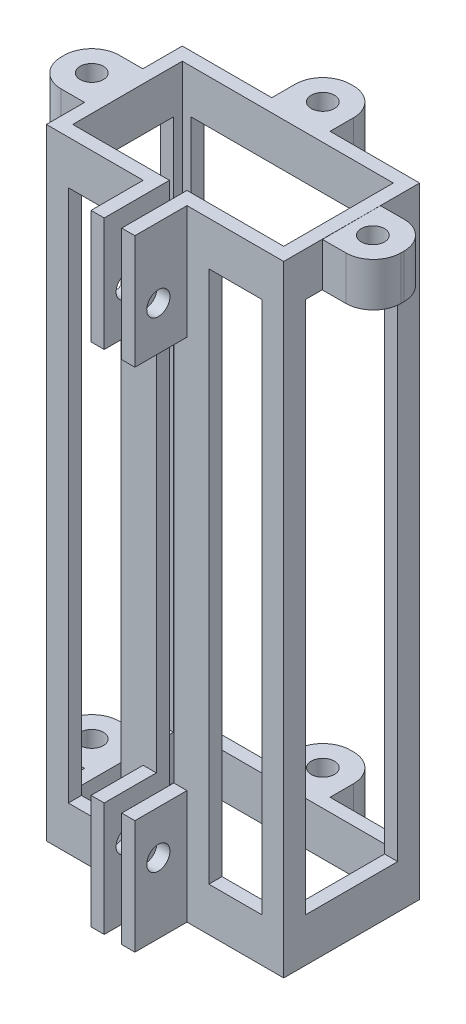
from build123d import *

# Parameters (mm, degrees)
BOSS_EXTRUDE1_DEPTH = 89.916
SKETCH2_W           = 28.036759992
SKETCH2_H           = 77.216
CUT_EXTRUDE1_DEPTH  = 1.905
SKETCH4_R           = 1.68021
CUT_EXTRUDE2_DEPTH  = 41.916
SKETCH5_R           = 1.68021
BOSS_EXTRUDE2_DEPTH = 6.35
SKETCH6_W           = 7.668379996
SKETCH6_H           = 77.216
CUT_EXTRUDE3_DEPTH  = 2.54
CUT_EXTRUDE4_DEPTH  = 12.7
SKETCH8_W           = 13.335
SKETCH8_H           = 77.216
CUT_EXTRUDE5_DEPTH  = 43.18
LPATTERN1_OUTLINE_R = 1.68021
LPATTERN1_DEPTH     = 6.35


# Read off the part's stored shape, not the designer's step: LPattern1
with BuildPart() as part:
    # Sketch1 → Boss-Extrude1 (new body)
    with BuildSketch(Plane(origin=(0, 0, 0), x_dir=(1, 0, 0), z_dir=(0, 1, 0))):
        Polygon((-15.28599651, -7.274771053), (-15.28599651, -0.044914733), (-15.28599651, 7.184941588), (-15.28599651, 7.892585267), (15.290763482, 7.892585267), (15.290763482, 7.184941588), (15.290763482, -7.274771053), (15.290763482, -7.982414733), (1.272383486, -7.982414733), (1.272383486, -17.434771053), (3.177383486, -17.434771053), (3.177383486, -9.887414733), (17.195763482, -9.887414733), (17.195763482, -7.982414733), (17.195763482, 9.797585267), (-15.28599651, 9.797585267), (-17.19099651, 9.797585267), (-17.19099651, -9.887414733), (-3.172616514, -9.887414733), (-3.172616514, -10.640741484), (-3.172616514, -17.434771053), (-1.267616514, -17.434771053), (-1.267616514, -7.982414733), (-15.28599651, -7.982414733), align=None)
    extrude(amount=BOSS_EXTRUDE1_DEPTH)

    # Sketch2 → Cut-Extrude1 (cut)
    with BuildSketch(Plane(origin=(0, 0, -9.797585267), x_dir=(-1, 0, 0), z_dir=(0, 0, -1))):
        with Locations((-0.002383486, 44.958)):
            Rectangle(SKETCH2_W, SKETCH2_H)
    extrude(amount=-CUT_EXTRUDE1_DEPTH, mode=Mode.SUBTRACT)

    # Sketch4 → Cut-Extrude2 (cut)
    with BuildSketch(Plane.ZY.offset(3.172616514)):
        with Locations((14.037756268, 10.16)):
            Circle(SKETCH4_R)
        with Locations((14.037756268, 79.756)):
            Circle(SKETCH4_R)
    extrude(amount=-CUT_EXTRUDE2_DEPTH, mode=Mode.SUBTRACT)

    # Sketch5 → Boss-Extrude2 (add)
    # profile 1 of 3: a face of its own
    with BuildSketch(Plane(origin=(0, 89.916, 0), x_dir=(1, 0, 0), z_dir=(0, 1, 0))):
        with BuildLine():
            Line((-24.58620651, 0.079810052), (-24.58620651, -0.360609948))
            ThreePointArc((-24.58620651, -0.360609948), (-23.414633635, -3.189037073), (-20.58620651, -4.360609948))
            Line((-20.58620651, -4.360609948), (-17.19099651, -4.360609948))
            Line((-17.19099651, -4.360609948), (-17.19099651, 4.079810052))
            Line((-17.19099651, 4.079810052), (-20.58620651, 4.079810052))
            ThreePointArc((-20.58620651, 4.079810052), (-23.414633635, 2.908237176), (-24.58620651, 0.079810052))
        make_face()
        with Locations(Location((-20.36599651, -0.140399948, 0), (0, 0, 270))):
            Circle(SKETCH5_R, mode=Mode.SUBTRACT)
    # profile 2 of 3: a face of its own
    with BuildSketch(Plane(origin=(0, 89.916, 0), x_dir=(1, 0, 0), z_dir=(0, 1, 0))):
        with BuildLine():
            Line((-4.22021, 13.192795267), (-4.22021, 9.797585267))
            Line((-4.22021, 9.797585267), (4.22021, 9.797585267))
            Line((4.22021, 9.797585267), (4.22021, 13.192795267))
            ThreePointArc((4.22021, 13.192795267), (3.048637125, 16.021222392), (0.22021, 17.192795267))
            Line((0.22021, 17.192795267), (-0.22021, 17.192795267))
            ThreePointArc((-0.22021, 17.192795267), (-3.048637125, 16.021222392), (-4.22021, 13.192795267))
        make_face()
        with Locations(Location((0, 12.972585267, 0), (0, 0, 270))):
            Circle(SKETCH5_R, mode=Mode.SUBTRACT)
    # profile 3 of 3: a face of its own
    with BuildSketch(Plane(origin=(0, 89.916, 0), x_dir=(1, 0, 0), z_dir=(0, 1, 0))):
        with BuildLine():
            ThreePointArc((20.600449894, 4.13134171), (23.431799841, 2.966850199), (24.610446744, 0.141363607))
            Line((24.610446744, 0.141363607), (24.611548826, -0.299055014))
            ThreePointArc((24.611548826, -0.299055014), (23.447057315, -3.130404961), (20.621570723, -4.309051864))
            Line((20.621570723, -4.309051864), (17.226371353, -4.317547845))
            Line((17.226371353, -4.317547845), (17.205250524, 4.122845729))
            Line((17.205250524, 4.122845729), (20.600449894, 4.13134171))
        make_face()
        with Locations(Location((20.36599651, -0.140399948, 0), (0, 0, 270))):
            Circle(SKETCH5_R, mode=Mode.SUBTRACT)
    extrude(amount=-BOSS_EXTRUDE2_DEPTH)


with BuildPart() as boss_extrude2_piece_1:
    # of the separate pieces the step leaves, piece 1, a body of its own (boss_extrude2_pieces)
    add(part.part.solids().sort_by_distance((-17.19099651, 0, -9.797585267))[0])

    # Sketch6 → Cut-Extrude3 (cut)
    with BuildSketch(Plane.XY.offset(9.887414733)):
        with Locations((-10.181806512, 44.958)):
            Rectangle(SKETCH6_W, SKETCH6_H)
    cut_extrude3 = extrude(amount=-CUT_EXTRUDE3_DEPTH, mode=Mode.SUBTRACT)

    # Mirror1: Cut-Extrude3 across plane
    add(cut_extrude3.mirror(Plane(origin=(0, 0, 0), x_dir=(0, 0, 1), z_dir=(1, 0, 0))), mode=Mode.SUBTRACT)

    # Sketch7 → Cut-Extrude4 (cut)
    with BuildSketch(Plane.ZY.offset(3.172616514)):
        Polygon((17.434771053, 73.406), (14.037756268, 73.406), (9.887414733, 73.406), (9.887414733, 16.51), (14.037756268, 16.51), (17.434771053, 16.51), align=None)
    extrude(amount=-CUT_EXTRUDE4_DEPTH, mode=Mode.SUBTRACT)

    # Sketch8 → Cut-Extrude5 (cut)
    with BuildSketch(Plane(origin=(17.195763482, 0, 0), x_dir=(0, 0, -1), z_dir=(1, 0, 0))):
        with Locations((-0.044914733, 44.958)):
            Rectangle(SKETCH8_W, SKETCH8_H)
    extrude(amount=-CUT_EXTRUDE5_DEPTH, mode=Mode.SUBTRACT)

    # LPattern1 outline → LPattern1 (add)
    # profile 1 of 2: a face of its own
    with BuildSketch(Plane(origin=(0, 0, 0), x_dir=(1, 0, 0), z_dir=(0, 1, 0))):
        with BuildLine():
            Line((-4.22021, 13.192795267), (-4.22021, 9.797585267))
            Line((-4.22021, 9.797585267), (4.22021, 9.797585267))
            Line((4.22021, 9.797585267), (4.22021, 13.192795267))
            ThreePointArc((4.22021, 13.192795267), (3.048637125, 16.021222392), (0.22021, 17.192795267))
            Line((0.22021, 17.192795267), (-0.22021, 17.192795267))
            ThreePointArc((-0.22021, 17.192795267), (-3.048637125, 16.021222392), (-4.22021, 13.192795267))
        make_face()
        with Locations((0, 12.972585267)):
            Circle(LPATTERN1_OUTLINE_R, mode=Mode.SUBTRACT)
    # profile 2 of 2: a face of its own
    with BuildSketch(Plane(origin=(0, 0, 0), x_dir=(1, 0, 0), z_dir=(0, 1, 0))):
        with BuildLine():
            Line((-17.19099651, 4.079810052), (-20.58620651, 4.079810052))
            ThreePointArc((-20.58620651, 4.079810052), (-23.414633634, 2.908237177), (-24.58620651, 0.079810052))
            Line((-24.58620651, 0.079810052), (-24.58620651, -0.360609948))
            ThreePointArc((-24.58620651, -0.360609948), (-23.414633635, -3.189037073), (-20.58620651, -4.360609948))
            Line((-20.58620651, -4.360609948), (-17.19099651, -4.360609948))
            Line((-17.19099651, -4.360609948), (-17.19099651, 4.079810052))
        make_face()
        with Locations((-20.36599651, -0.140399948)):
            Circle(LPATTERN1_OUTLINE_R, mode=Mode.SUBTRACT)
    extrude(amount=LPATTERN1_DEPTH)


with BuildPart() as boss_extrude2_piece_2:
    # of the separate pieces the step leaves, piece 2, a body of its own (boss_extrude2_pieces)
    add(part.part.solids().sort_by_distance((20.600449894, 89.916, -4.13134171))[0])


solid = Compound([boss_extrude2_piece_1.part, boss_extrude2_piece_2.part])
